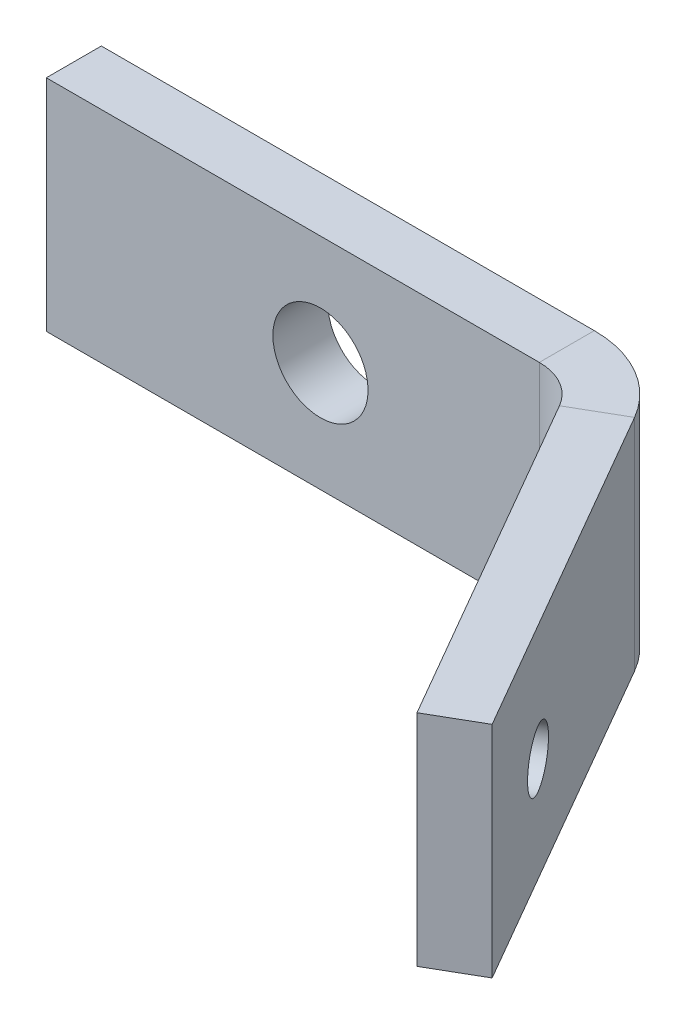
from build123d import *

# Parameters (mm, degrees)
ESBO_O1_W               = 56
ESBO_O1_H               = 12.7
FLANGE_BASE1_DEPTH      = 3.18
DOBRA_START             = -6.35
DOBRA_ESBO_ADA1_DEPTH   = 12.7
DOBRA_ESBO_ADA1_2_DEPTH = 12.7
ESBO_O7_R               = 2.75
CORTE_EXTRUS_O2_DEPTH   = 10
ESBO_O11_R              = 1.65
CORTE_EXTRUS_O3_DEPTH   = 10


# Read off the part's stored shape, not the designer's step: Dobra esboçada1
# Sheet-metal steps are written as plain solids
with BuildPart() as part:
    # Esboço1 → Flange-base1 (new body)
    with BuildSketch(Plane.XY):
        Rectangle(ESBO_O1_W, ESBO_O1_H)
    extrude(amount=-FLANGE_BASE1_DEPTH)

    # Dobra esboçada1 outline → Dobra esboçada1 (cut)
    with BuildSketch(Plane(origin=(0, 0, 0), x_dir=(1, 0, 0), z_dir=(0, 1, 0)).offset(DOBRA_START)):
        with BuildLine():
            ThreePointArc((0.50243384, 3.18), (3.68243384, 2.327921568), (6.010355408, 0))
            Line((6.010355408, 0), (28, 0))
            Line((28, 0), (28, 3.18))
            Line((28, 3.18), (0.50243384, 3.18))
        make_face()
    extrude(amount=DOBRA_ESBO_ADA1_DEPTH, mode=Mode.SUBTRACT)

    # Dobra esbo_ada1 2 outline → Dobra esbo_ada1 2 (add)
    with BuildSketch(Plane(origin=(0, 0, 0), x_dir=(1, 0, 0), z_dir=(0, 1, 0)).offset(DOBRA_START)):
        with BuildLine():
            Line((3.256394624, -1.59), (14.507611545, -21.077679353))
            Line((14.507611545, -21.077679353), (17.261572329, -19.487679353))
            Line((17.261572329, -19.487679353), (6.010355408, 0))
            Line((6.010355408, 0), (0.50243384, 0))
            ThreePointArc((0.50243384, 0), (2.09243384, -0.426039216), (3.256394624, -1.59))
        make_face()
    extrude(amount=DOBRA_ESBO_ADA1_2_DEPTH)

    # Esboço7 → Corte-extrusão2 (cut)
    with BuildSketch(Plane(origin=(0, 0, -3.18), x_dir=(-1, 0, 0), z_dir=(0, 0, -1))):
        with Locations((12.150906248, 0)):
            Circle(ESBO_O7_R)
    extrude(amount=-CORTE_EXTRUS_O2_DEPTH, mode=Mode.SUBTRACT)

    # Esboço11 → Corte-extrusão3 (cut)
    with BuildSketch(Plane(origin=(1.753805772, 0, -1.012560235), x_dir=(0.49999999999999806, 0, 0.8660254037844398), z_dir=(-0.8660254037844397, 0, 0.499999999999998))):
        with Locations((18.257611545, -0.33)):
            Circle(ESBO_O11_R)
    extrude(amount=-CORTE_EXTRUS_O3_DEPTH, mode=Mode.SUBTRACT)


solid = part.part
